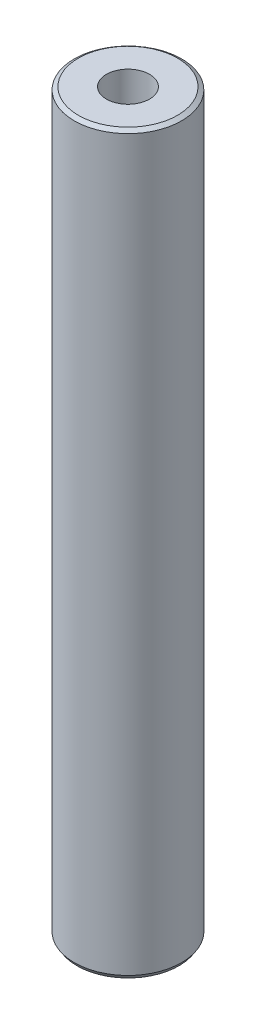
from build123d import *
from OCP.BRepFilletAPI import BRepFilletAPI_MakeChamfer

# Parameters (mm, degrees)
SKETCH1_R           = 40
BOSS_EXTRUDE1_DEPTH = 548.262568205
SKETCH2_R           = 16.051724709
CUT_EXTRUDE1_DEPTH  = 552.17315219
CHAMFER1_SIZE       = 2.012978496
CHAMFER1_SIZE2      = 3.065631328


with BuildPart() as part:
    # Sketch1 → Boss-Extrude1 (new body)
    with BuildSketch(Plane(origin=(0, 0, 0), x_dir=(1, 0, 0), z_dir=(0, 1, 0))):
        Circle(SKETCH1_R)
    extrude(amount=BOSS_EXTRUDE1_DEPTH)

    # Sketch2 → Cut-Extrude1 (cut, through all)
    with BuildSketch(Plane(origin=(0, 0, 0), x_dir=(1, 0, 0), z_dir=(0, 1, 0))):
        Circle(SKETCH2_R)
    extrude(amount=CUT_EXTRUDE1_DEPTH, mode=Mode.SUBTRACT)

    # Chamfer1: one chamfer whose edges measure the first distance from different faces: ONE call of the kernel's chamfer builder (chamfer() names one face for all edges)
    chamfer1_edges_1 = [part.edges().sort_by_distance(p)[0] for p in [
        (-40, 548.262568205, 0),
    ]]
    chamfer1_side_1 = [part.faces().sort_by_distance(p)[0] for p in [
        (-40, 274.131284103, 0),
    ]]
    chamfer1_edges_2 = [part.edges().sort_by_distance(p)[0] for p in [
        (-40, 0, 0),
    ]]
    chamfer1_side_2 = [part.faces().sort_by_distance(p)[0] for p in [
        (-38.86862915, 0, 0),
    ]]
    chamfer1 = BRepFilletAPI_MakeChamfer(part.part.solid().wrapped)
    for e in chamfer1_edges_1:
        chamfer1.Add(CHAMFER1_SIZE, CHAMFER1_SIZE2, e.wrapped, chamfer1_side_1[0].wrapped)  # the first distance lies on this face
    for e in chamfer1_edges_2:
        chamfer1.Add(CHAMFER1_SIZE, CHAMFER1_SIZE2, e.wrapped, chamfer1_side_2[0].wrapped)  # the first distance lies on this face
    add(Compound.cast(chamfer1.Shape()), mode=Mode.REPLACE)


solid = part.part
